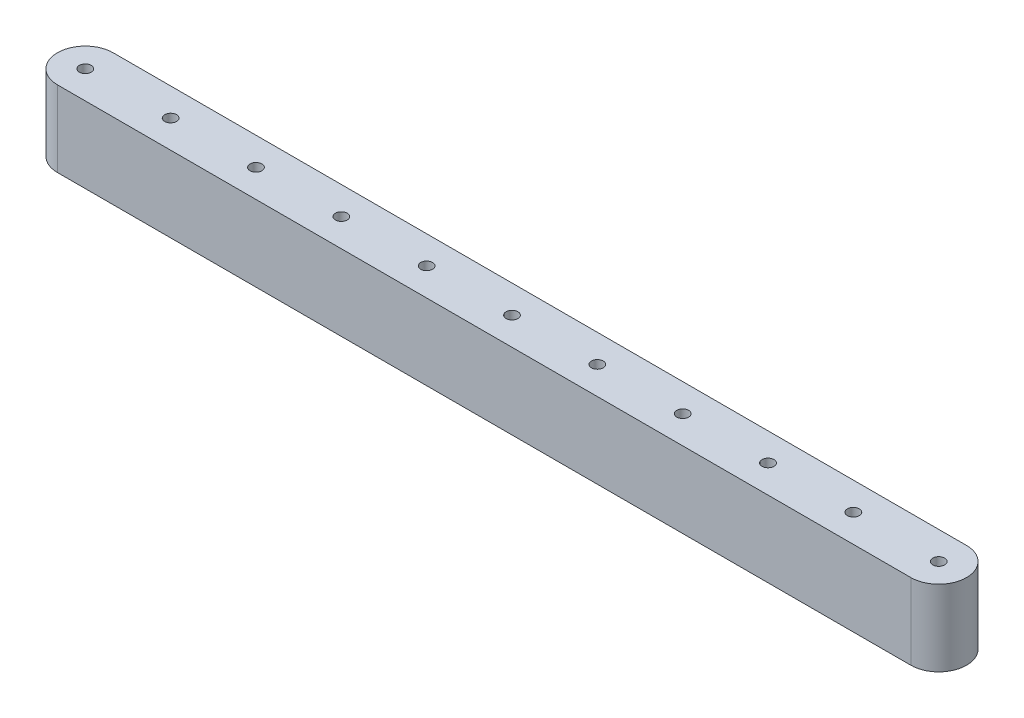
from build123d import *

# Parameters (mm, degrees)
BOSS_EXTRUDE1_DEPTH     = 6.499999954
CUT_EXTRUDE1_DEPTH      = 79.203750306
CUT_EXTRUDE1_DEPTH_BACK = 79.203750306
SKETCH2_R               = 1.016


with BuildPart() as part:
    # Sketch1 → Boss-Extrude1 (new, symmetric)
    with BuildSketch(Plane(origin=(0, 0, 0), x_dir=(1, 0, 0), z_dir=(0, 1, 0))):
        with BuildLine():
            Line((-73.025, 4.7625), (73.025, 4.7625))
            ThreePointArc((73.025, 4.7625), (77.7875, 0), (73.025, -4.7625))
            Line((73.025, -4.7625), (-73.025, -4.7625))
            ThreePointArc((-73.025, -4.7625), (-77.7875, 0), (-73.025, 4.7625))
        make_face()
    extrude(amount=BOSS_EXTRUDE1_DEPTH, both=True)

    # Sketch2 → Cut-Extrude1 (cut, two sides: drawn at the far end of the back side and taken through both)
    with BuildSketch(Plane(origin=(0, 0, 0), x_dir=(1, 0, 0), z_dir=(0, 1, 0)).offset(-CUT_EXTRUDE1_DEPTH_BACK)):
        with Locations((-73.025, 0)):
            Circle(SKETCH2_R)
        with Locations((-58.42, 0)):
            Circle(SKETCH2_R)
        with Locations((-43.815, 0)):
            Circle(SKETCH2_R)
        with Locations((-29.21, 0)):
            Circle(SKETCH2_R)
        with Locations((-14.605, 0)):
            Circle(SKETCH2_R)
        Circle(SKETCH2_R)
        with Locations((14.605, 0)):
            Circle(SKETCH2_R)
        with Locations((29.21, 0)):
            Circle(SKETCH2_R)
        with Locations((43.815, 0)):
            Circle(SKETCH2_R)
        with Locations((58.42, 0)):
            Circle(SKETCH2_R)
        with Locations((73.025, 0)):
            Circle(SKETCH2_R)
    extrude(amount=CUT_EXTRUDE1_DEPTH + CUT_EXTRUDE1_DEPTH_BACK, mode=Mode.SUBTRACT)


solid = part.part
